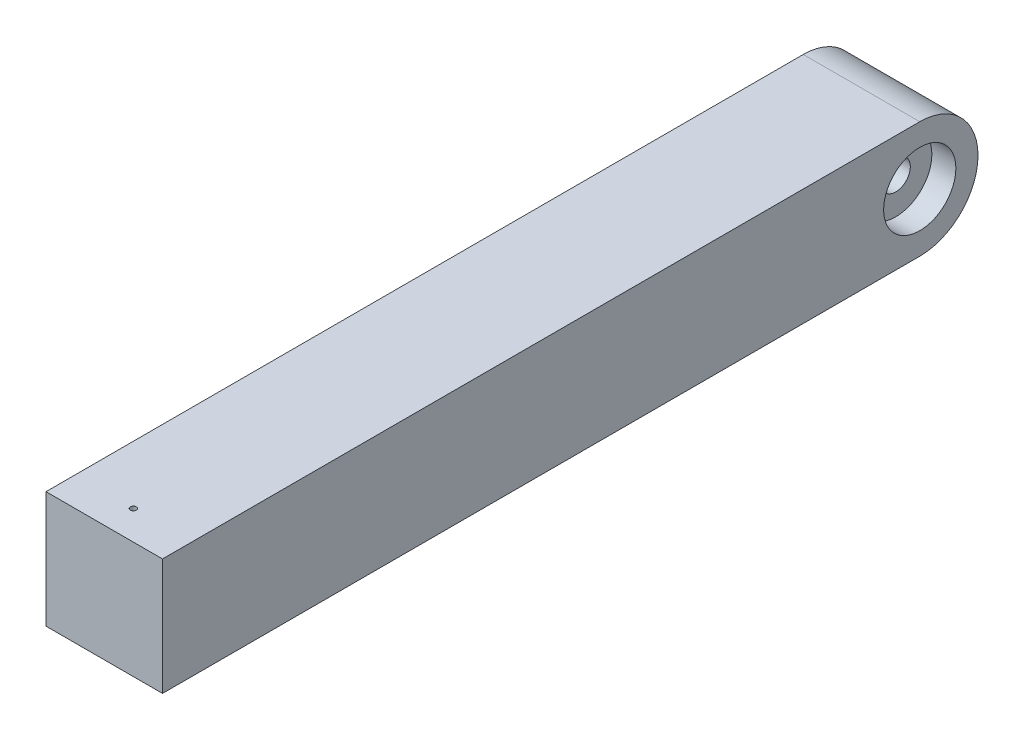
from build123d import *

# Parameters (mm, degrees)
SKETCH1_W                       = 100
SKETCH1_H                       = 100
BOSS_EXTRUDE1_DEPTH             = 700
FILLET1_R                       = 50
SKETCH2_R                       = 31
CUT_EXTRUDE1_DEPTH              = 100
F_5_0MM_DOWEL_HOLE1_D           = 5
F_5_0MM_DOWEL_HOLE1_CSINK_D     = 5.05
F_5_0MM_DOWEL_HOLE1_CSINK_ANGLE = 90
BOSS_EXTRUDE2_DEPTH             = 29.4
BOSS_EXTRUDE2_DEPTH_BACK        = 29.4
SKETCH6_R                       = 31
SKETCH6_R_2                     = 12.5


with BuildPart() as part:
    # Sketch1 → Boss-Extrude1 (new body)
    with BuildSketch(Plane(origin=(0, 0, 0), x_dir=(0, 1, 0), z_dir=(0, 0, 1))):
        Rectangle(SKETCH1_W, SKETCH1_H)
    extrude(amount=-BOSS_EXTRUDE1_DEPTH)

    # Fillet1
    fillet1_edges = [part.edges().sort_by_distance(p)[0] for p in [
        (0, -50, -700),
        (0, 50, -700),
    ]]
    fillet(fillet1_edges, radius=FILLET1_R - 0.0001)  # a hair under: the kernel refuses the full size

    # Sketch2 → Cut-Extrude1 (cut)
    with BuildSketch(Plane.YZ.offset(50)):
        with Locations((0, -650)):
            Circle(SKETCH2_R)
    extrude(amount=-CUT_EXTRUDE1_DEPTH, mode=Mode.SUBTRACT)

    # Ø5.0mm Dowel Hole1 (through all)
    with Locations(Plane.XZ.offset(50)):
        with Locations((0, -25)):
            f_5_0mm_dowel_hole1 = CounterSinkHole(F_5_0MM_DOWEL_HOLE1_D / 2, F_5_0MM_DOWEL_HOLE1_CSINK_D / 2, counter_sink_angle=F_5_0MM_DOWEL_HOLE1_CSINK_ANGLE)

    # Mirror1: Ø5.0mm Dowel Hole1 across plane
    add(f_5_0mm_dowel_hole1.mirror(Plane.ZX), mode=Mode.SUBTRACT)

    # Sketch6 → Boss-Extrude2 (add, two sides: drawn at the far end of the back side and taken through both)
    with BuildSketch(Plane.YZ.offset(-BOSS_EXTRUDE2_DEPTH_BACK)):
        with Locations(Location((0, -650, 0), (0, 0, 270))):
            Circle(SKETCH6_R)
        with Locations(Location((0, -650, 0), (0, 0, 270))):
            Circle(SKETCH6_R_2, mode=Mode.SUBTRACT)
    extrude(amount=BOSS_EXTRUDE2_DEPTH + BOSS_EXTRUDE2_DEPTH_BACK)


solid = part.part
